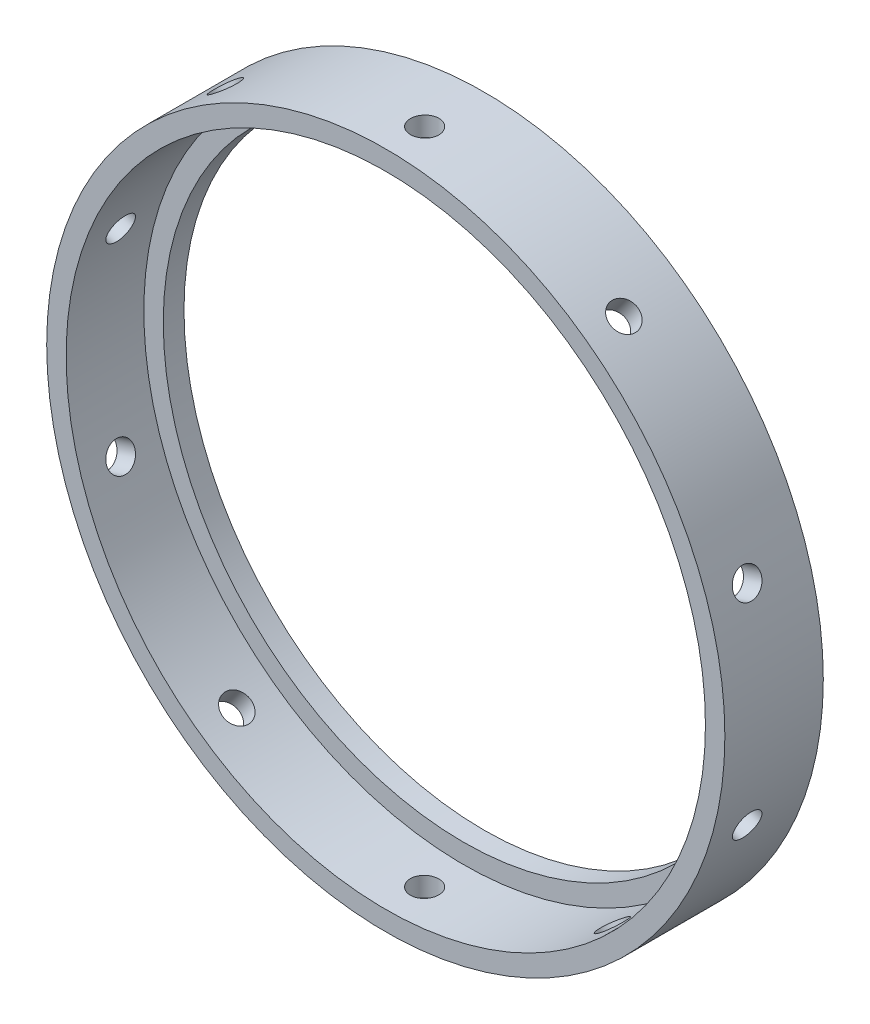
from build123d import *

# Parameters (mm, degrees)
SKETCH1_R           = 83.1215
SKETCH1_R_2         = 78.359
BOSS_EXTRUDE1_DEPTH = 19.05
SKETCH2_R           = 3.478244762
CUT_EXTRUDE1_DEPTH  = 120.085137715
CIRPATTERN1_COUNT   = 10
BOSS_EXTRUDE2_START = 5.08
SKETCH3_R           = 83.1215
SKETCH3_R_2         = 73.5965
BOSS_EXTRUDE2_DEPTH = 5.08


with BuildPart() as part:
    # Sketch1 → Boss-Extrude1 (new body)
    with BuildSketch(Plane.XY):
        Circle(SKETCH1_R)
        Circle(SKETCH1_R_2, mode=Mode.SUBTRACT)
    extrude(amount=BOSS_EXTRUDE1_DEPTH)

    # Sketch2 → Cut-Extrude1 (cut, through all)
    with BuildSketch(Plane(origin=(0, 0, 0), x_dir=(1, 0, 0), z_dir=(0, 1, 0))):
        with Locations((0, -9.525)):
            Circle(SKETCH2_R)
    cut_extrude1 = extrude(amount=-CUT_EXTRUDE1_DEPTH, mode=Mode.SUBTRACT)

    # CirPattern1: Cut-Extrude1 ×10 about axis
    cirpattern1_axis = Axis((0, 0, 2.080715754), (0, 0, 1))
    for i in range(1, CIRPATTERN1_COUNT):
        add(cut_extrude1.rotate(cirpattern1_axis, i * 360 / CIRPATTERN1_COUNT), mode=Mode.SUBTRACT)

    # Sketch3 → Boss-Extrude2 (add)
    with BuildSketch(Plane(origin=(0, 0, 0), x_dir=(-1, 0, 0), z_dir=(0, 0, -1)).offset(BOSS_EXTRUDE2_START)):
        Circle(SKETCH3_R)
        Circle(SKETCH3_R_2, mode=Mode.SUBTRACT)
    extrude(amount=-BOSS_EXTRUDE2_DEPTH)


solid = part.part
